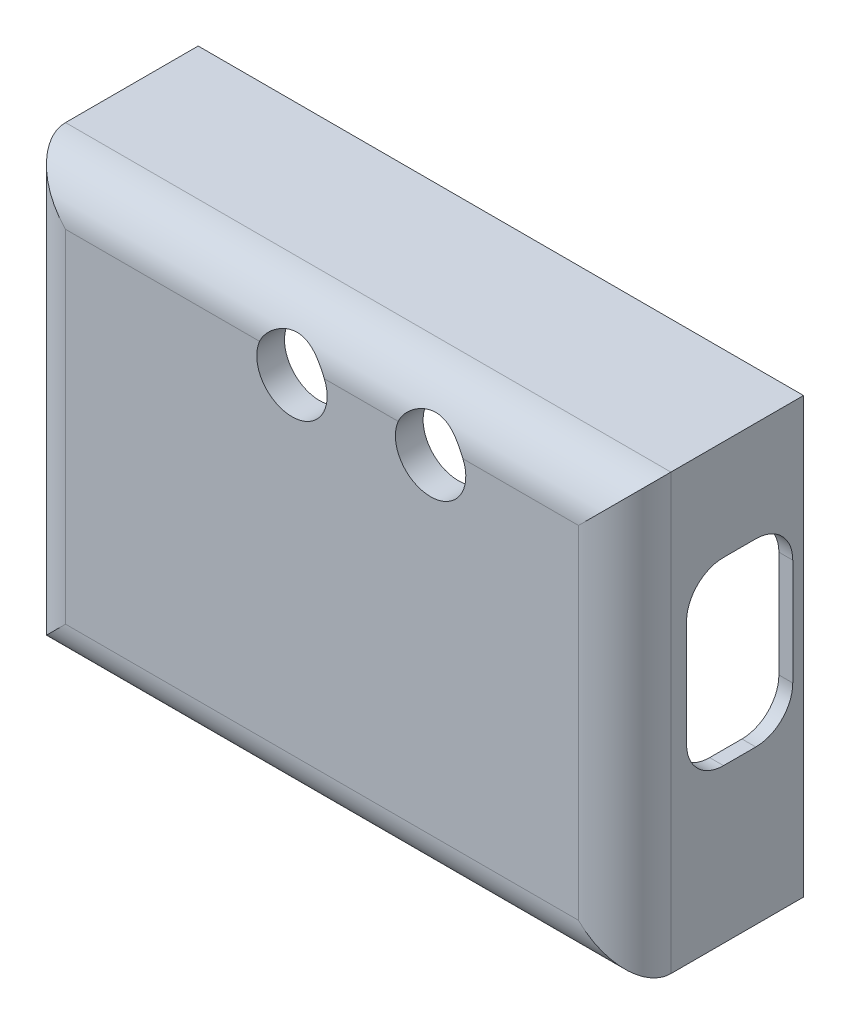
from build123d import *

# Parameters (mm, degrees)
BOSS_EXTRUDE1_DEPTH      = 13.97
BOSS_EXTRUDE1_DEPTH_BACK = 2.38125
SKETCH1_W                = 65.5
SKETCH1_H                = 47
SKETCH1_W_2              = 62.5
SKETCH1_H_2              = 44
SKETCH2_W                = 3.58
SKETCH2_H                = 3.58
BOSS_EXTRUDE2_DEPTH      = 13.97
SKETCH3_W                = 65.5
SKETCH3_H                = 47
SKETCH3_R                = 3.81
BOSS_EXTRUDE3_DEPTH      = 3
FILLET1_R                = 5
CUT_EXTRUDE1_DEPTH       = 1.5


with BuildPart() as part:
    # Sketch1 → Boss-Extrude1 (new, two sides: drawn at the far end of the back side and taken through both)
    with BuildSketch(Plane.XY.offset(-BOSS_EXTRUDE1_DEPTH_BACK)):
        with Locations((-101.75, -91.5)):
            Rectangle(SKETCH1_W, SKETCH1_H)
        with Locations((-101.75, -91.5)):
            Rectangle(SKETCH1_W_2, SKETCH1_H_2, mode=Mode.SUBTRACT)
    extrude(amount=BOSS_EXTRUDE1_DEPTH + BOSS_EXTRUDE1_DEPTH_BACK)

    # Sketch2 → Boss-Extrude2 (add)
    with BuildSketch(Plane.XY.offset(13.97)):
        with Locations((-131.21, -71.29)):
            Rectangle(SKETCH2_W, SKETCH2_H)
        with Locations((-131.21, -111.71)):
            Rectangle(SKETCH2_W, SKETCH2_H)
        with Locations((-72.29, -111.71)):
            Rectangle(SKETCH2_W, SKETCH2_H)
        with Locations((-72.29, -71.29)):
            Rectangle(SKETCH2_W, SKETCH2_H)
    extrude(amount=-BOSS_EXTRUDE2_DEPTH)

    # Sketch3 → Boss-Extrude3 (add)
    with BuildSketch(Plane.XY.offset(13.97)):
        with Locations((-101.75, -91.5)):
            Rectangle(SKETCH3_W, SKETCH3_H)
        with Locations((-105, -74.5)):
            Circle(SKETCH3_R, mode=Mode.SUBTRACT)
        with Locations((-90, -74.5)):
            Circle(SKETCH3_R, mode=Mode.SUBTRACT)
    extrude(amount=BOSS_EXTRUDE3_DEPTH)

    # Fillet1
    # the kernel refuses this fillet: 5 mm, written as the material it takes off along each edge
    with BuildSketch(Plane(origin=(-56.5, -68, 16.97), x_dir=(0, -1, 0), z_dir=(-1, 0, 0))) as fillet1_piece_1:
        with BuildLine():
            CenterArc((FILLET1_R, -FILLET1_R), FILLET1_R, 90, 90)
            Line((0, -FILLET1_R), (0, 0))
            Line((0, 0), (FILLET1_R, 0))
        make_face()
    extrude(amount=90.5, mode=Mode.SUBTRACT)
    with BuildSketch(Plane(origin=(-134.5, -55.5, 16.97), x_dir=(0, 0, -1), z_dir=(0, -1, 0)), Plane(origin=(-69, -127.5, 16.97), x_dir=(0, 0, -1), z_dir=(0, 1, 0))) as fillet1_piece_2:
        with BuildLine():
            CenterArc((FILLET1_R, FILLET1_R), FILLET1_R, 180, 90)
            Line((0, FILLET1_R), (0, 0))
            Line((0, 0), (FILLET1_R, 0))
        make_face()
    extrude(amount=72, mode=Mode.SUBTRACT)
    with BuildSketch(Plane(origin=(-147, -115, 16.97), x_dir=(0, 0, -1), z_dir=(1, 0, 0))) as fillet1_piece_3:
        with BuildLine():
            CenterArc((FILLET1_R, FILLET1_R), FILLET1_R, 180, 90)
            Line((0, FILLET1_R), (0, 0))
            Line((0, 0), (FILLET1_R, 0))
        make_face()
    extrude(amount=90.5, mode=Mode.SUBTRACT)

    # Sketch4 → Cut-Extrude1 (cut)
    with BuildSketch(Plane(origin=(-69, 0, 0), x_dir=(0, 0, -1), z_dir=(1, 0, 0))):
        with BuildLine():
            ThreePointArc((-10.276157649, -82.847028828), (-9.104584774, -80.018601703), (-6.276157649, -78.847028828))
            Line((-6.276157649, -78.847028828), (-2.784881052, -78.847028828))
            ThreePointArc((-2.784881052, -78.847028828), (0.043546073, -80.018601703), (1.215118948, -82.847028828))
            Line((1.215118948, -82.847028828), (1.215118948, -94.351328143))
            ThreePointArc((1.215118948, -94.351328143), (0.043546073, -97.179755268), (-2.784881052, -98.351328143))
            Line((-2.784881052, -98.351328143), (-6.276157649, -98.351328143))
            ThreePointArc((-6.276157649, -98.351328143), (-9.104584774, -97.179755268), (-10.276157649, -94.351328143))
            Line((-10.276157649, -94.351328143), (-10.276157649, -82.847028828))
        make_face()
    extrude(amount=-CUT_EXTRUDE1_DEPTH, mode=Mode.SUBTRACT)


solid = part.part
